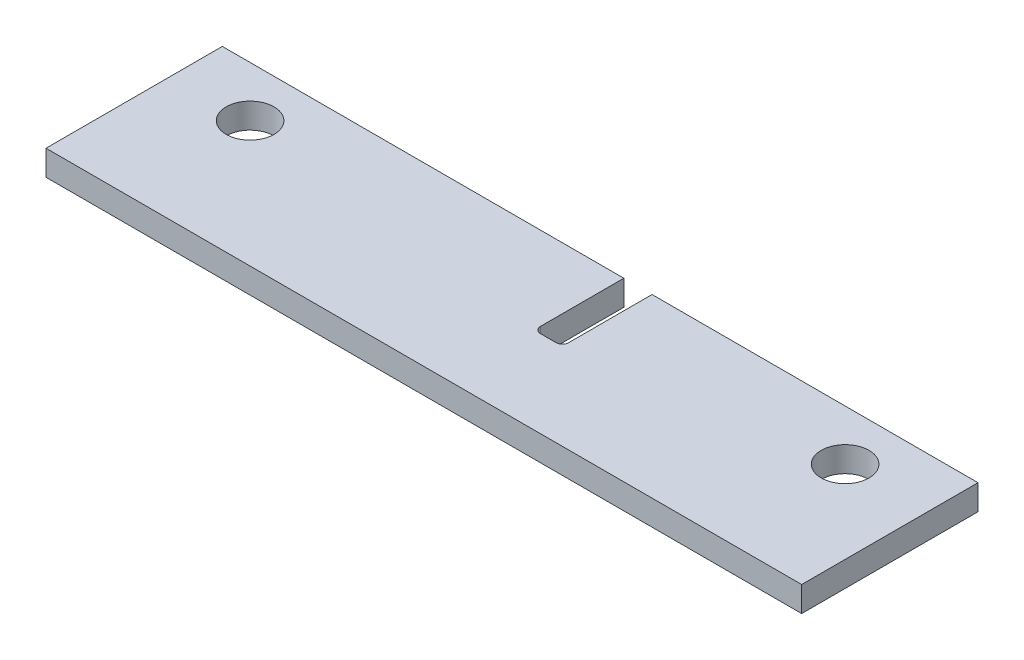
from build123d import *

# Parameters (mm, degrees)
BOSS_EXTRUDE1_DEPTH      = 50.8
BOSS_EXTRUDE1_DEPTH_BACK = 38.1
SKETCH2_W                = 381
SKETCH2_H                = 12.7
SKETCH3_W                = 12.7
SKETCH3_H                = 44.45
CUT_EXTRUDE1_DEPTH       = 2664.230012597
CAVITY1_START            = 115.8
CAVITY1_OUTLINE_R        = 12.7
CAVITY1_DEPTH            = 12.7
MOVE_FACE_HOLES_BY       = 0.635
MOVE_FACE_HOLES_2_BY     = 0.635
MOVE_FACE2_BY            = 0.762
MOVE_FACE2_2_BY          = 0.762
MOVE_FACE2_3_BY          = 0.762
SLOT_FILLET_R            = 3.175


# Read off the part's stored shape, not the designer's step: Cavity1
with BuildPart() as part:
    # Sketch2 → Boss-Extrude1 (new, two sides: drawn at the far end of the back side and taken through both)
    with BuildSketch(Plane.XY.offset(287.7).offset(-BOSS_EXTRUDE1_DEPTH_BACK)):
        with Locations((2451.1, 122.15)):
            Rectangle(SKETCH2_W, SKETCH2_H)
    extrude(amount=BOSS_EXTRUDE1_DEPTH + BOSS_EXTRUDE1_DEPTH_BACK)

    # Sketch3 → Cut-Extrude1 (cut, through all)
    with BuildSketch(Plane(origin=(0, 128.5, 0), x_dir=(1, 0, 0), z_dir=(0, 1, 0))):
        with Locations((2470.15, -271.825)):
            Rectangle(SKETCH3_W, SKETCH3_H)
    extrude(amount=-CUT_EXTRUDE1_DEPTH, mode=Mode.SUBTRACT)

    # Cavity1 outline → Cavity1 (cut)
    with BuildSketch(Plane(origin=(0, 0, 0), x_dir=(1, 0, 0), z_dir=(0, 1, 0)).offset(CAVITY1_START)):
        with Locations((2300, -275)):
            Circle(CAVITY1_OUTLINE_R)
        with Locations((2600, -275)):
            Circle(CAVITY1_OUTLINE_R)
    extrude(amount=CAVITY1_DEPTH, mode=Mode.SUBTRACT)

    # Move Face Holes: a curved face moved outward by 0.635
    add(Solid.thicken(part.faces().sort_by_distance((2587.3, 122.15, 275))[0], MOVE_FACE_HOLES_BY))

    # Move Face Holes 2: a curved face moved outward by 0.635
    add(Solid.thicken(part.faces().sort_by_distance((2287.3, 122.15, 275))[0], MOVE_FACE_HOLES_2_BY))

    # Move Face2: a face moved inward by 0.762
    extrude(part.faces().sort_by_distance((2470.15, 122.15, 294.05))[0], amount=MOVE_FACE2_BY, dir=(0, 0, 1), mode=Mode.SUBTRACT)

    # Move Face2 2: a face moved inward by 0.762
    extrude(part.faces().sort_by_distance((2476.5, 122.15, 271.825))[0], amount=MOVE_FACE2_2_BY, dir=(1, 0, 0), mode=Mode.SUBTRACT)

    # Move Face2 3: a face moved inward by 0.762
    extrude(part.faces().sort_by_distance((2463.8, 122.15, 271.825))[0], amount=MOVE_FACE2_3_BY, dir=(-1, 0, 0), mode=Mode.SUBTRACT)

    # Slot Fillet
    slot_fillet_edges = [part.edges().sort_by_distance(p)[0] for p in [
        (2477.262, 122.15, 294.812),
        (2463.038, 122.15, 294.812),
    ]]
    fillet(slot_fillet_edges, radius=SLOT_FILLET_R)


solid = part.part
